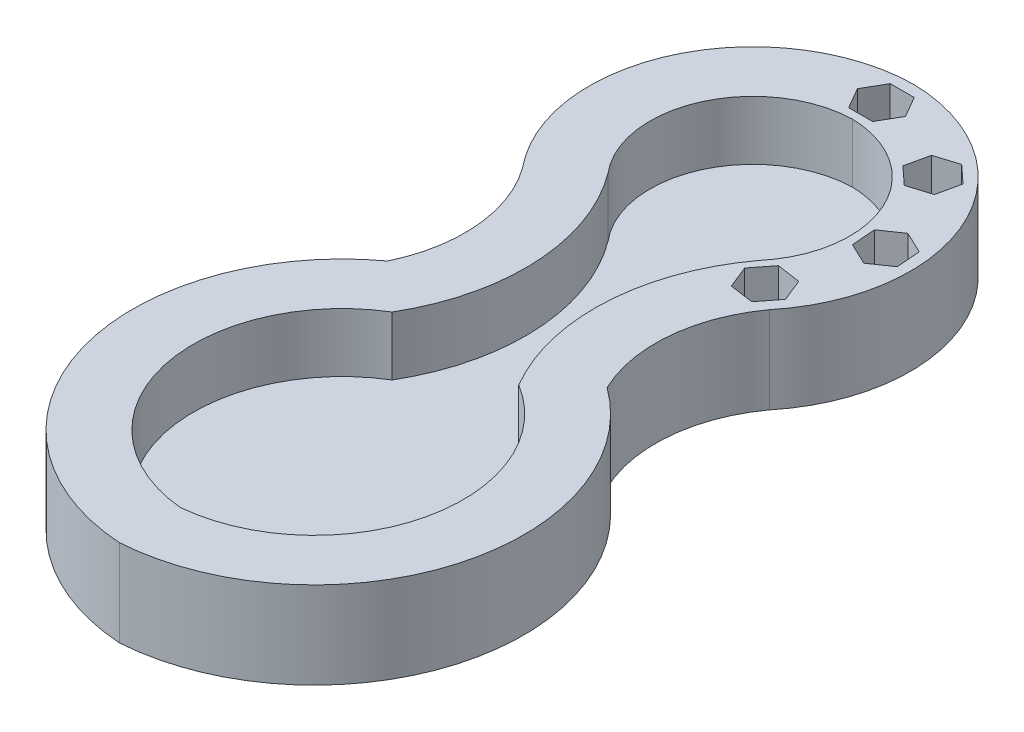
from build123d import *

# Parameters (mm, degrees)
BOSS_EXTRUDE1_DEPTH = 18.161
CUT_EXTRUDE1_DEPTH  = 24.638
CUT_EXTRUDE2_DEPTH  = 19.05
CRVPATTERN1_START   = -0.889
CRVPATTERN1_DEPTH   = 19.05


# Read off the part's stored shape, not the designer's step: CrvPattern1
with BuildPart() as part:
    # Sketch1 → Boss-Extrude1 (new, symmetric)
    with BuildSketch(Plane(origin=(0, 0, 0), x_dir=(1, 0, 0), z_dir=(0, 1, 0))):
        with BuildLine():
            Line((0, 66.607667907), (0, -265.604400607))
            ThreePointArc((0, -265.604400607), (-78.340784416, -202.581490406), (-45.87811803, -107.421934899))
            ThreePointArc((-45.87811803, -107.421934899), (-40.160322886, -75.527015006), (-51.603877928, -45.211604003))
            ThreePointArc((-51.603877928, -45.211604003), (-60.864208699, 26.879044906), (0, 66.607667907))
        make_face()
    boss_extrude1 = extrude(amount=BOSS_EXTRUDE1_DEPTH, both=True)

    # Mirror1: Boss-Extrude1 across plane
    add(boss_extrude1.mirror(Plane(origin=(0, 0, 0), x_dir=(0, 0, 1), z_dir=(1, 0, 0))))

    # Sketch2 → Cut-Extrude1 (cut)
    with BuildSketch(Plane(origin=(0, 18.161, 0), x_dir=(1, 0, 0), z_dir=(0, 1, 0))):
        with BuildLine():
            ThreePointArc((0, 41.200992494), (-38.018423714, 15.7584639), (-31.604351091, -29.535933937))
            ThreePointArc((-31.604351091, -29.535933937), (-14.627606963, -76.491037862), (-26.48852554, -124.99165885))
            ThreePointArc((-26.48852554, -124.99165885), (-54.824707805, -192.124773269), (0, -240.125249216))
            ThreePointArc((0, -240.125249216), (54.824707805, -192.124773269), (26.48852554, -124.99165885))
            ThreePointArc((26.48852554, -124.99165885), (14.627606963, -76.491037862), (31.604351091, -29.535933937))
            ThreePointArc((31.604351091, -29.535933937), (38.018423714, 15.7584639), (0, 41.200992494))
        make_face()
    extrude(amount=-CUT_EXTRUDE1_DEPTH, mode=Mode.SUBTRACT)

    # Sketch3 → Cut-Extrude2 (cut)
    with BuildSketch(Plane(origin=(0, 18.161, 0), x_dir=(1, 0, 0), z_dir=(0, 1, 0))):
        Polygon((10.046315092, 53.239317383), (5.023157546, 61.939681467), (-5.023157546, 61.939681467), (-10.046315092, 53.239317383), (-5.023157546, 44.538953299), (5.023157546, 44.538953299), align=None)
    extrude(amount=-CUT_EXTRUDE2_DEPTH, mode=Mode.SUBTRACT)

    # CrvPattern1 outline → CrvPattern1 (cut)
    with BuildSketch(Plane(origin=(0, 0, 0), x_dir=(1, 0, 0), z_dir=(0, 1, 0)).offset(CRVPATTERN1_START)):
        Polygon((37.533514674, -27.403244166), (31.332053305, -35.307061206), (35.076228964, -44.629592813), (45.021865992, -46.048307379), (51.223327362, -38.144490339), (47.479151703, -28.821958732), align=None)
        Polygon((44.628135866, 5.689936437), (45.431707419, -4.32418957), (54.505980714, -8.635339196), (62.776682456, -2.932362814), (61.973110904, 7.081763193), (52.898837609, 11.392912818), align=None)
        Polygon((27.396514919, 34.820049581), (34.77897318, 28.006257908), (44.371118995, 30.992758468), (46.580806549, 40.7930507), (39.198348288, 47.606842373), (29.606202473, 44.620341813), align=None)
    extrude(amount=CRVPATTERN1_DEPTH, mode=Mode.SUBTRACT)


solid = part.part
